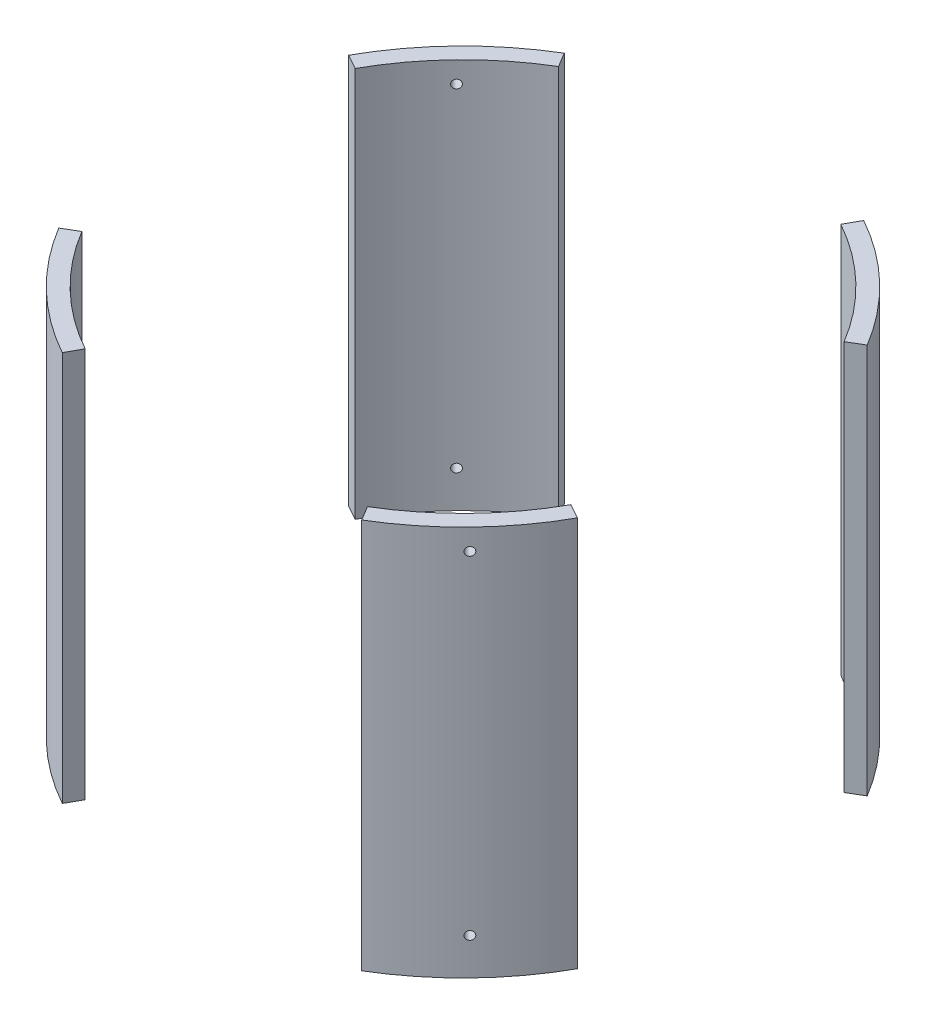
from build123d import *

# Parameters (mm, degrees)
SKETCH2_R               = 88.9
SKETCH2_R_2             = 83.82
BOSS_EXTRUDE1_DEPTH     = 58.90133
CUT_EXTRUDE1_DEPTH      = 139.837266884
CUT_EXTRUDE1_DEPTH_BACK = 139.837266884
SKETCH5_R               = 1.27
BOLT_HOLES_DEPTH        = 200.730478421
BOLT_PATTERN_COUNT      = 4


with BuildPart() as part:
    # Sketch2 → Boss-Extrude1 (new, symmetric)
    with BuildSketch(Plane(origin=(0, 0, 0), x_dir=(1, 0, 0), z_dir=(0, 1, 0))):
        Circle(SKETCH2_R)
        Circle(SKETCH2_R_2, mode=Mode.SUBTRACT)
    extrude(amount=BOSS_EXTRUDE1_DEPTH, both=True)

    # Sketch3 → Cut-Extrude1 (cut, two sides: drawn at the far end of the back side and taken through both)
    with BuildSketch(Plane(origin=(0, 0, 0), x_dir=(1, 0, 0), z_dir=(0, 1, 0)).offset(-CUT_EXTRUDE1_DEPTH_BACK)):
        Polygon((-58.116685864, 96.974944394), (0, 0), (53.900027233, 96.974944394), align=None)
        Polygon((70.991745134, -118.45858783), (0, 0), (-65.840936026, -118.45858783), align=None)
        Polygon((169.661755759, 101.677593364), (0, 0), (169.661755759, -94.300371224), align=None)
        Polygon((-123.741299607, -74.157652604), (0, 0), (-123.741299607, 68.777140945), align=None)
    extrude(amount=CUT_EXTRUDE1_DEPTH + CUT_EXTRUDE1_DEPTH_BACK, mode=Mode.SUBTRACT)


with BuildPart() as cut_extrude1_piece_1:
    # of the separate pieces the step leaves, piece 1, a body of its own (cut_extrude1_pieces)
    add(part.part.solids().sort_by_distance((-45.699187432, -58.90133, -76.254798328))[0])


with BuildPart() as cut_extrude1_piece_2:
    # of the separate pieces the step leaves, piece 2, a body of its own (cut_extrude1_pieces)
    add(part.part.solids().sort_by_distance((45.699187432, -58.90133, 76.254798328))[0])


with BuildPart() as cut_extrude1_piece_3:
    # of the separate pieces the step leaves, piece 3, a body of its own (cut_extrude1_pieces)
    add(part.part.solids().sort_by_distance((76.254798328, -58.90133, -45.699187432))[0])


with BuildPart() as cut_extrude1_piece_4:
    # of the separate pieces the step leaves, piece 4, a body of its own (cut_extrude1_pieces)
    add(part.part.solids().sort_by_distance((-76.254798328, -58.90133, 45.699187432))[0])

    # Sketch5 → Bolt holes (cut, through all)
    with BuildSketch(Plane(origin=(-56.309218645, 0, 58.175814955), x_dir=(-0.7185401515036821, 0, -0.6954854784084752), z_dir=(0.6954854784084752, 0, -0.7185401515036821))):
        with Locations((-0.02278764, 52.55133)):
            Circle(SKETCH5_R)
        with Locations((-0.02278764, -47.78883)):
            Circle(SKETCH5_R)
    bolt_holes = extrude(amount=-BOLT_HOLES_DEPTH, mode=Mode.SUBTRACT)


with BuildPart() as bolt_pattern_tool:
    # Bolt pattern: Bolt holes ×4 about axis
    bolt_pattern_axis = Axis((0, 58.90133, 0), (0, 1, 0))
    for i in range(1, BOLT_PATTERN_COUNT):
        add(bolt_holes.rotate(bolt_pattern_axis, i * 360 / BOLT_PATTERN_COUNT))


with BuildPart() as cut_extrude1_piece_1_1:
    add(cut_extrude1_piece_1.part)

    # Bolt pattern: cut by bolt_pattern_tool
    add(bolt_pattern_tool.part, mode=Mode.SUBTRACT)


with BuildPart() as cut_extrude1_piece_2_1:
    add(cut_extrude1_piece_2.part)

    # Bolt pattern: cut by bolt_pattern_tool
    add(bolt_pattern_tool.part, mode=Mode.SUBTRACT)


with BuildPart() as cut_extrude1_piece_3_1:
    add(cut_extrude1_piece_3.part)

    # Bolt pattern: cut by bolt_pattern_tool
    add(bolt_pattern_tool.part, mode=Mode.SUBTRACT)


solid = Compound([cut_extrude1_piece_4.part, cut_extrude1_piece_1_1.part, cut_extrude1_piece_2_1.part, cut_extrude1_piece_3_1.part])
